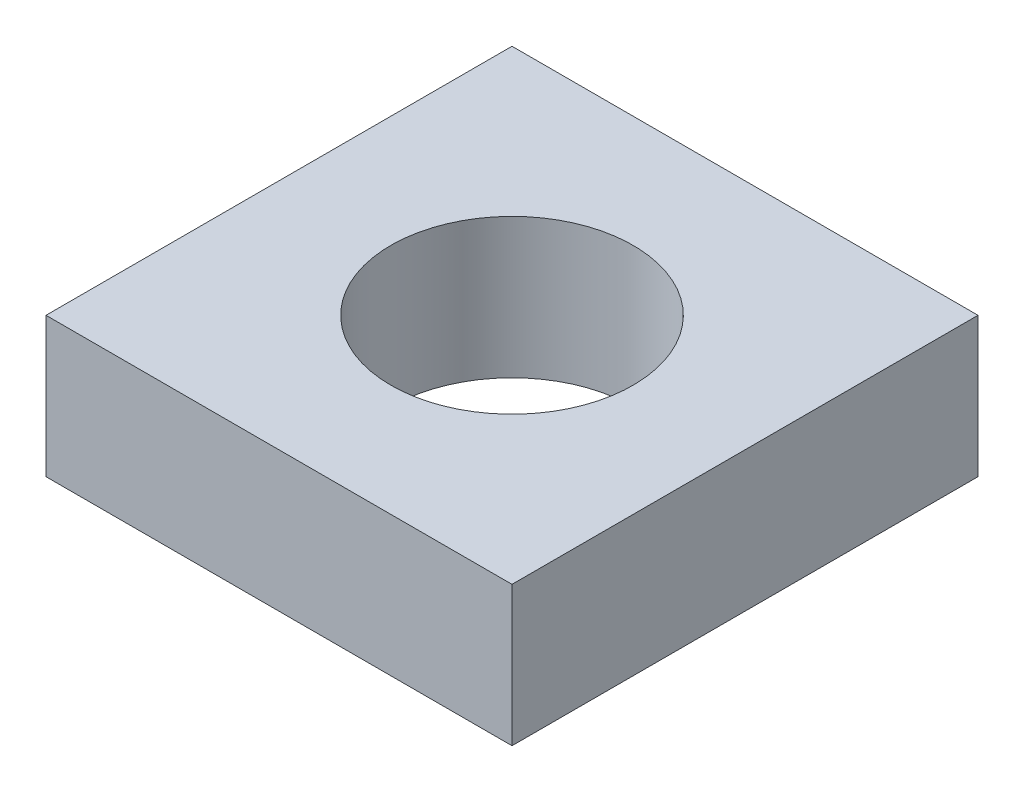
from build123d import *

# Parameters (mm, degrees)
SKETCH1_W           = 12.7
SKETCH1_H           = 12.7
BOSS_EXTRUDE1_DEPTH = 3.81
SKETCH3_R           = 3.302
CUT_EXTRUDE1_DEPTH  = 10.7550551


with BuildPart() as part:
    # Sketch1 → Boss-Extrude1 (new body)
    with BuildSketch(Plane(origin=(0, 0, 0), x_dir=(1, 0, 0), z_dir=(0, 1, 0))):
        Rectangle(SKETCH1_W, SKETCH1_H)
    extrude(amount=BOSS_EXTRUDE1_DEPTH)

    # Sketch3 → Cut-Extrude1 (cut, through all)
    with BuildSketch(Plane(origin=(0, 3.81, 0), x_dir=(1, 0, 0), z_dir=(0, 1, 0))):
        Circle(SKETCH3_R)
    extrude(amount=-CUT_EXTRUDE1_DEPTH, mode=Mode.SUBTRACT)


solid = part.part
